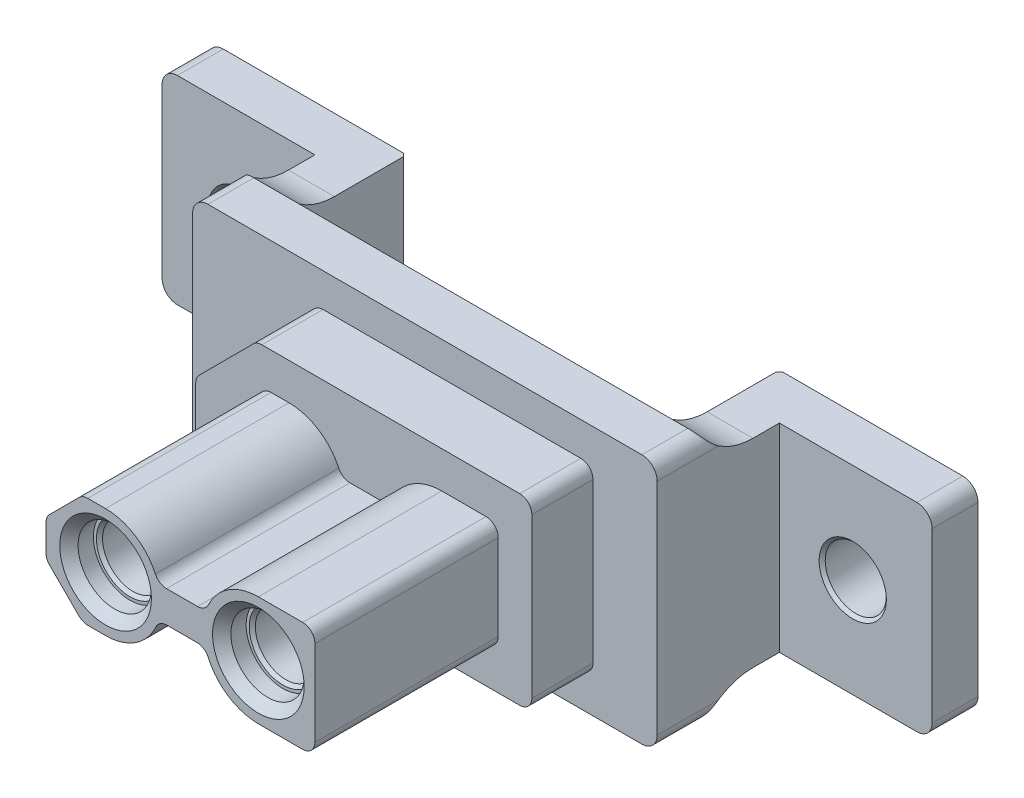
from build123d import *
from build123d.topology import SkipClean

# Parameters (mm, degrees)
SKETCH_1_R           = 1.2
EXTRUDE_1_DEPTH      = 6
EXTRUDE_START        = 2
SKETCH_2_R           = 1.2
EXTRUDE_2_DEPTH      = 2
EXTRUDE_START_2      = 1.5
SKETCH_3_W           = 15.2
SKETCH_3_H           = 8.2
SKETCH_3_R           = 1.2
EXTRUDE_3_DEPTH      = 1.5
SKETCH_4_W           = 1.5
SKETCH_4_H           = 6.5
EXTRUDE_4_DEPTH      = 4
SKETCH_5_W           = 1.5
SKETCH_5_H           = 6.5
EXTRUDE_5_DEPTH      = 5
SKETCH_6_W           = 1.5
SKETCH_6_H           = 6.5
EXTRUDE_6_DEPTH      = 5
FILLET_1_R           = 2
FILLET_2_R           = 0.5
SKETCH_7_R           = 1
CUT_EXTRUDE_1_DEPTH  = 5
CHAMFER_1_SIZE       = 0.1
CUT_EXTRUDE_2_DEPTH  = 2
EXTRUDE_7_DEPTH      = 4.9
EXTRUDE_7_DEPTH_BACK = 6.7
SKETCH_9_R           = 1.2
SKETCH_10_R          = 1
CUT_EXTRUDE_3_DEPTH  = 6
CHAMFER_2_SIZE       = 0.1
CHAMFER_3_SIZE       = 0.3
SKETCH_11_R          = 0.5
CUT_EXTRUDE_4_DEPTH  = 4.9
CUT_EXTRUDE_9_DEPTH  = 2.9
FILLET_3_R           = 0.1
CHAMFER_4_SIZE       = 0.3
CHAMFER_5_SIZE       = 0.4
SKETCH_13_W          = 1.346153846
SKETCH_13_H          = 0.358974359
EXTRUDE_8_DEPTH      = 0.1
EXTRUDE_13_DEPTH     = 0.1


with BuildPart() as part:
    # Эскиз1 → Бобышка-Вытянуть1 (new body)
    with BuildSketch(Plane.XY):
        with BuildLine():
            Line((2.258794489, 1.8), (3.708794489, 1.8))
            ThreePointArc((3.708794489, 1.8), (3.991637202, 1.682842712), (4.108794489, 1.4))
            Line((4.108794489, 1.4), (4.108794489, -1.4))
            ThreePointArc((4.108794489, -1.4), (3.991637202, -1.682842712), (3.708794489, -1.8))
            Line((3.708794489, -1.8), (2.258794489, -1.8))
            ThreePointArc((2.258794489, -1.8), (1.280391338, -1.510869707), (0.616305952, -0.736363636))
            ThreePointArc((0.616305952, -0.736363636), (0.468731422, -0.564251176), (0.251308499, -0.5))
            Line((0.251308499, -0.5), (-0.733719521, -0.5))
            ThreePointArc((-0.733719521, -0.5), (-0.951142443, -0.564251176), (-1.098716973, -0.736363636))
            ThreePointArc((-1.098716973, -0.736363636), (-1.762802359, -1.510869707), (-2.741205511, -1.8))
            Line((-2.741205511, -1.8), (-3.325520086, -1.8))
            ThreePointArc((-3.325520086, -1.8), (-3.478593459, -1.769551813), (-3.608362798, -1.682842712))
            Line((-3.608362798, -1.682842712), (-4.574048223, -0.717157288))
            ThreePointArc((-4.574048223, -0.717157288), (-4.660757324, -0.587387948), (-4.691205511, -0.434314575))
            Line((-4.691205511, -0.434314575), (-4.691205511, 0.434314575))
            ThreePointArc((-4.691205511, 0.434314575), (-4.660757324, 0.587387948), (-4.574048223, 0.717157288))
            Line((-4.574048223, 0.717157288), (-3.608362798, 1.682842712))
            ThreePointArc((-3.608362798, 1.682842712), (-3.478593459, 1.769551813), (-3.325520086, 1.8))
            Line((-3.325520086, 1.8), (-2.741205511, 1.8))
            ThreePointArc((-2.741205511, 1.8), (-1.773933587, 1.518020101), (-1.109718597, 0.760427807))
            ThreePointArc((-1.109718597, 0.760427807), (-0.962115266, 0.592073965), (-0.747165949, 0.529411765))
            Line((-0.747165949, 0.529411765), (0.264754928, 0.529411765))
            ThreePointArc((0.264754928, 0.529411765), (0.479704244, 0.592073965), (0.627307576, 0.760427807))
            ThreePointArc((0.627307576, 0.760427807), (1.291522566, 1.518020101), (2.258794489, 1.8))
        make_face()
        with Locations((2.258794489, 0)):
            Circle(SKETCH_1_R, mode=Mode.SUBTRACT)
        with Locations((-2.741205511, 0)):
            Circle(SKETCH_1_R, mode=Mode.SUBTRACT)
    extrude(amount=EXTRUDE_1_DEPTH)

    # Эскиз2 → Бобышка-Вытянуть2 (add)
    with SkipClean():  # the faces are left unmerged after this step: merging them gives an invalid solid
        with BuildSketch(Plane(origin=(0, 0, 0), x_dir=(-1, 0, 0), z_dir=(0, 0, -1)).offset(EXTRUDE_START)):
            with BuildLine():
                Line((3.908362798, 2.882842712), (5.674048223, 1.117157288))
                ThreePointArc((5.674048223, 1.117157288), (5.760757324, 0.987387948), (5.791205511, 0.834314575))
                Line((5.791205511, 0.834314575), (5.791205511, -2.6))
                ThreePointArc((5.791205511, -2.6), (5.674048223, -2.882842712), (5.391205511, -3))
                Line((5.391205511, -3), (-4.808794489, -3))
                ThreePointArc((-4.808794489, -3), (-5.091637202, -2.882842712), (-5.208794489, -2.6))
                Line((-5.208794489, -2.6), (-5.208794489, 2.6))
                ThreePointArc((-5.208794489, 2.6), (-5.091637202, 2.882842712), (-4.808794489, 3))
                Line((-4.808794489, 3), (3.625520086, 3))
                ThreePointArc((3.625520086, 3), (3.778593459, 2.969551813), (3.908362798, 2.882842712))
            make_face()
            with Locations((-2.258794489, 0)):
                Circle(SKETCH_2_R, mode=Mode.SUBTRACT)
            with Locations((2.741205511, 0)):
                Circle(SKETCH_2_R, mode=Mode.SUBTRACT)
        extrude(amount=-EXTRUDE_2_DEPTH)

    # Эскиз3 → Бобышка-Вытянуть3 (add)
    with SkipClean():  # the faces are left unmerged after this step: merging them gives an invalid solid
        with BuildSketch(Plane(origin=(0, 0, -2), x_dir=(-1, 0, 0), z_dir=(0, 0, -1)).offset(EXTRUDE_START_2)):
            with Locations((0.291205511, 0)):
                Rectangle(SKETCH_3_W, SKETCH_3_H)
            with Locations((2.741205511, 0)):
                Circle(SKETCH_3_R, mode=Mode.SUBTRACT)
            with Locations((-2.258794489, 0)):
                Circle(SKETCH_3_R, mode=Mode.SUBTRACT)
        extrude(amount=-EXTRUDE_3_DEPTH)

    # Эскиз4 → Бобышка-Вытянуть4 (add)
    with SkipClean():  # the faces are left unmerged after this step: merging them gives an invalid solid
        with BuildSketch(Plane(origin=(0, 0, -3.5), x_dir=(-1, 0, 0), z_dir=(0, 0, -1))):
            with Locations((-6.558794489, 0)):
                Rectangle(SKETCH_4_W, SKETCH_4_H)
            with Locations((7.141205511, 0)):
                Rectangle(SKETCH_4_W, SKETCH_4_H)
        extrude(amount=EXTRUDE_4_DEPTH)

    # Эскиз5 → Бобышка-Вытянуть5 (add)
    with SkipClean():  # the faces are left unmerged after this step: merging them gives an invalid solid
        with BuildSketch(Plane.ZY.offset(7.891205511)):
            with Locations((-6.75, 0)):
                Rectangle(SKETCH_5_W, SKETCH_5_H)
        extrude(amount=EXTRUDE_5_DEPTH)

    # Эскиз6 → Бобышка-Вытянуть6 (add)
    with SkipClean():  # the faces are left unmerged after this step: merging them gives an invalid solid
        with BuildSketch(Plane(origin=(7.308794489, 0, 0), x_dir=(0, 0, -1), z_dir=(1, 0, 0))):
            with Locations((6.75, 0)):
                Rectangle(SKETCH_6_W, SKETCH_6_H)
        extrude(amount=EXTRUDE_6_DEPTH)

    # Скругление1
    # the kernel refuses this fillet: 2 mm, written as the material it adds along each edge
    with BuildSketch(Plane(origin=(-7.891205511, 3.25, -3.5), x_dir=(-1.4802973661668755e-15, 1.0, -6.489449500614614e-12), z_dir=(1, 0, 0)), Plane(origin=(-6.391205511, -3.25, -3.5), x_dir=(0, -1.0, -6.475343137478438e-12), z_dir=(-1, 0, 0)), Plane(origin=(7.308794489, -3.25, -3.5), x_dir=(0, -1.0, -6.4972863690237275e-12), z_dir=(-1, 0, 0)), Plane(origin=(5.808794489, 3.25, -3.5), x_dir=(0, 1.0, -6.489449500614672e-12), z_dir=(1, 0, 0))) as fillet_1_piece_1:
        with BuildLine():
            CenterArc((2, -1.636306817), FILLET_1_R, 125.099632196, 54.900367805)
            Line((0, -1.636306817), (-0.04, -1.636306817))
            Line((-0.04, -1.636306817), (-0.04, 0))
            Line((-0.04, 0), (0, 0.04))
            ThreePointArc((0, 0.04), (0.425, 0.04), (0.827, 0.032726136))
            Line((0.827, 0.032726136), (0.85, 0))
        make_face()
    extrude(amount=1.5)

    # Скругление2
    # the kernel refuses this fillet: 0.5 mm, written as the material it adds along each edge
    with BuildSketch(Plane(origin=(5.808794489, 4.1, -3.5), x_dir=(0, 0, -1), z_dir=(0, -1, 0))) as fillet_2_piece_1_section:
        with BuildLine():
            CenterArc((FILLET_2_R, -FILLET_2_R), FILLET_2_R, 90, 90)
            Line((0, -FILLET_2_R), (0, 0))
            Line((0, 0), (FILLET_2_R, 0))
        make_face()
    fillet_2_piece_1 = extrude(amount=8.2, mode=Mode.PRIVATE)
    fillet_2_piece_1 = fillet_2_piece_1 - Plane(origin=(5.693650373, -5.25, -5.136306817), x_dir=(0, -1.0, -6e-12), z_dir=(1, 0, 0)) * Cylinder(2, 19, mode=Mode.PRIVATE)
    fillet_2_piece_1 = fillet_2_piece_1 - Plane(origin=(5.693650373, 5.25, -5.136306817), x_dir=(0, 1.0, -6e-12), z_dir=(-1, 0, 0)) * Cylinder(2, 19, mode=Mode.PRIVATE)
    add(fillet_2_piece_1)
    with BuildSketch(Plane(origin=(-6.391205511, 4.1, -3.5), x_dir=(0, 0, -1), z_dir=(0, -1, 0))) as fillet_2_piece_2_section:
        with BuildLine():
            CenterArc((FILLET_2_R, FILLET_2_R), FILLET_2_R, 180, 90)
            Line((0, FILLET_2_R), (0, 0))
            Line((0, 0), (FILLET_2_R, 0))
        make_face()
    fillet_2_piece_2 = extrude(amount=8.2, mode=Mode.PRIVATE)
    fillet_2_piece_2 = fillet_2_piece_2 - Plane(origin=(-6.276061394, 5.25, -5.136306817), x_dir=(0, 1.0, -6e-12), z_dir=(-1, 0, 0)) * Cylinder(2, 19, mode=Mode.PRIVATE)
    fillet_2_piece_2 = fillet_2_piece_2 - Plane(origin=(-6.276061394, -5.25, -5.136306817), x_dir=(0, -1.0, -6e-12), z_dir=(1, 0, 0)) * Cylinder(2, 19, mode=Mode.PRIVATE)
    add(fillet_2_piece_2)
    # the kernel refuses this fillet: 0.5 mm, written as the material it takes off along each edge
    with BuildSketch(Plane(origin=(-7.891205511, -4.1, -4.75), x_dir=(0, 1, 0), z_dir=(0, 0, 1)), Plane(origin=(7.308794489, 4.1, -4.75), x_dir=(0, -1, 0), z_dir=(0, 0, 1)), Plane(origin=(-12.891205511, -3.25, -4.75), x_dir=(1, 0, 0), z_dir=(0, 0, -1))) as fillet_2_2_piece_1:
        with BuildLine():
            CenterArc((FILLET_2_R, -FILLET_2_R), FILLET_2_R, 90, 90)
            Line((0, -FILLET_2_R), (0, 0))
            Line((0, 0), (FILLET_2_R, 0))
        make_face()
    extrude(amount=4, mode=Mode.SUBTRACT)
    with BuildSketch(Plane(origin=(-7.891205511, 4.1, -4.75), x_dir=(0, -1, 0), z_dir=(0, 0, 1)), Plane(origin=(7.308794489, -4.1, -4.75), x_dir=(0, 1, 0), z_dir=(0, 0, 1)), Plane(origin=(-12.891205511, 3.25, -8.75), x_dir=(0, -1, 0), z_dir=(0, 0, 1)), Plane(origin=(12.308794489, 3.25, -8.75), x_dir=(-1, 0, 0), z_dir=(0, 0, 1)), Plane(origin=(12.308794489, -3.25, -4.75), x_dir=(-1, 0, 0), z_dir=(0, 0, -1))) as fillet_2_2_piece_2:
        with BuildLine():
            CenterArc((FILLET_2_R, FILLET_2_R), FILLET_2_R, 180, 90)
            Line((0, FILLET_2_R), (0, 0))
            Line((0, 0), (FILLET_2_R, 0))
        make_face()
    extrude(amount=4, mode=Mode.SUBTRACT)

    # Эскиз7 → Вырез-Вытянуть1 (cut)
    with BuildSketch(Plane.XY.offset(-6)):
        with Locations((-10.291205511, 0)):
            Circle(SKETCH_7_R)
        with Locations((9.708794489, 0)):
            Circle(SKETCH_7_R)
    extrude(amount=-CUT_EXTRUDE_1_DEPTH, mode=Mode.SUBTRACT)

    # Фаска1
    chamfer_1_edges = [part.edges().sort_by_distance(p)[0] for p in [
        (5.808794489, 0, -7.5),
        (-6.391205511, 0, -7.5),
        (-11.291205511, 0, -6),
        (8.708794489, 0, -6),
    ]]
    chamfer(chamfer_1_edges, length=CHAMFER_1_SIZE)

    # Эскиз8 → Вырез-Вытянуть2 (cut)
    with BuildSketch(Plane(origin=(0, 0, -3.5), x_dir=(-1, 0, 0), z_dir=(0, 0, -1))):
        with BuildLine():
            Line((-2.258794489, 2), (2.741205511, 2))
            ThreePointArc((2.741205511, 2), (4.741205511, 0), (2.741205511, -2))
            Line((2.741205511, -2), (-3.258794489, -2))
            ThreePointArc((-3.258794489, -2), (-3.965901271, -1.707106781), (-4.258794489, -1))
            Line((-4.258794489, -1), (-4.258794489, 1))
            ThreePointArc((-4.258794489, 1), (-3.965901271, 1.707106781), (-3.258794489, 2))
            Line((-3.258794489, 2), (-2.258794489, 2))
        make_face()
    extrude(amount=-CUT_EXTRUDE_2_DEPTH, mode=Mode.SUBTRACT)

    # Эскиз9 → Бобышка-Вытянуть7 (add, two sides: drawn at the far end of the back side and taken through both)
    with BuildSketch(Plane(origin=(0, 0, -1.5), x_dir=(-1, 0, 0), z_dir=(0, 0, -1)).offset(-EXTRUDE_7_DEPTH_BACK)):
        with Locations(Location((-2.258794489, 0, 0), (0, 0, 180))):
            Circle(SKETCH_9_R)
        with Locations(Location((2.741205511, 0, 0), (0, 0, 180))):
            Circle(SKETCH_9_R)
    extrude(amount=EXTRUDE_7_DEPTH + EXTRUDE_7_DEPTH_BACK)

    # Эскиз10 → Вырез-Вытянуть3 (cut)
    with BuildSketch(Plane.XY.offset(5.2)):
        with Locations((-2.741205511, 0)):
            Circle(SKETCH_10_R)
        with Locations((2.258794489, 0)):
            Circle(SKETCH_10_R)
    extrude(amount=-CUT_EXTRUDE_3_DEPTH, mode=Mode.SUBTRACT)

    # Фаска2
    chamfer_2_edges = [part.edges().sort_by_distance(p)[0] for p in [
        (-3.741205511, 0, 5.2),
        (1.258794489, 0, 5.2),
    ]]
    chamfer(chamfer_2_edges, length=CHAMFER_2_SIZE)

    # Фаска3
    chamfer_3_edges = [part.edges().sort_by_distance(p)[0] for p in [
        (1.058794489, 0, 6),
        (-3.941205511, 0, 6),
    ]]
    chamfer(chamfer_3_edges, length=CHAMFER_3_SIZE)

    # Эскиз11 → Вырез-Вытянуть4 (cut)
    with BuildSketch(Plane(origin=(0, 0, -6.4), x_dir=(-1, 0, 0), z_dir=(0, 0, -1))):
        with Locations((-2.258794489, 0)):
            Circle(SKETCH_11_R)
        with Locations((2.741205511, 0)):
            Circle(SKETCH_11_R)
    extrude(amount=-CUT_EXTRUDE_4_DEPTH, mode=Mode.SUBTRACT)

    # Эскиз12 → Вырез-Вытянуть9 (cut)
    with BuildSketch(Plane(origin=(0, 0, -6.4), x_dir=(-1, 0, 0), z_dir=(0, 0, -1))):
        Polygon((-3.458794489, 0), (3.941205511, 0), (4.595085028, 3.242285216), (-4.658523769, 3.242285216), align=None)
    extrude(amount=-CUT_EXTRUDE_9_DEPTH, mode=Mode.SUBTRACT)

    # Скругление3
    fillet_3_edges = [part.edges().sort_by_distance(p)[0] for p in [
        (2.258794489, -0.5, -6.4),
        (-2.741205511, -0.5, -6.4),
        (-2.741205511, -1.2, -6.4),
        (2.258794489, -1.2, -6.4),
        (3.108794489, 0, -6.4),
        (1.408794489, 0, -6.4),
        (-1.891205511, 0, -6.4),
        (-3.591205511, 0, -6.4),
    ]]
    fillet(fillet_3_edges, radius=FILLET_3_R)

    # Фаска4
    chamfer_4_edges = [part.edges().sort_by_distance(p)[0] for p in [
        (2.758794489, 0, -1.5),
        (-2.241205511, 0, -1.5),
    ]]
    chamfer(chamfer_4_edges, length=CHAMFER_4_SIZE)

    # Фаска5
    chamfer_5_edges = [part.edges().sort_by_distance(p)[0] for p in [
        (-3.741205511, 0, -0.8),
        (1.258794489, 0, -0.8),
    ]]
    chamfer(chamfer_5_edges, length=CHAMFER_5_SIZE)

    # Эскиз13 → Бобышка-Вытянуть8 (add)
    with BuildSketch(Plane(origin=(0, 0, -3.5), x_dir=(-1, 0, 0), z_dir=(0, 0, -1))):
        Polygon((-3.440798391, 3.176805897), (-2.63951634, 3.176805897), (-2.63951634, 3.978087949), (-2.351054801, 3.978087949), (-2.351054801, 3.176805897), (-1.54977275, 3.176805897), (-1.54977275, 2.888344359), (-2.351054801, 2.888344359), (-2.351054801, 2.087062308), (-2.63951634, 2.087062308), (-2.63951634, 2.888344359), (-3.440798391, 2.888344359), align=None)
        with Locations((1.938889093, 3.014669105)):
            Rectangle(SKETCH_13_W, SKETCH_13_H)
    extrude(amount=EXTRUDE_8_DEPTH)

    # Эскиз14 → Бобышка-Вытянуть13 (add)
    # profile 1 of 5: a face of its own
    with BuildSketch(Plane(origin=(0, 0, -3.5), x_dir=(-1, 0, 0), z_dir=(0, 0, -1))):
        with BuildLine():
            Line((-3.107035782, -3.844522884), (-3.107035782, -3.636189551))
            Line((-3.107035782, -3.636189551), (-3.038676407, -3.636189551))
            add(Edge.make_bspline(
                [(-3.038676407, -3.636189551), (-3.025758735, -3.636122847), (-3.002726179, -3.636003914), (-2.972316243, -3.633949557), (-2.950054155, -3.631734993), (-2.934743369, -3.627329652), (-2.924975895, -3.620399853), (-2.918928165, -3.611352031), (-2.915318624, -3.600209672), (-2.914885284, -3.592057407), (-2.914652969, -3.587686946)],
                knots=[0, 0, 0, 0, 2.052523213, 3.65970388, 4.842635394, 5.606133253, 6.161486309, 6.706841923, 7.306733098, 8, 8, 8, 8], degree=3))
            add(Edge.make_bspline(
                [(-2.914652969, -3.587686946), (-2.914715799, -3.581489469), (-2.914837519, -3.569482956), (-2.917599166, -3.551845564), (-2.920213954, -3.534718891), (-2.923029123, -3.523542014), (-2.924418594, -3.518025488)],
                knots=[0, 0, 0, 0, 1.053051773, 2.04010098, 3.032660624, 4, 4, 4, 4], degree=3))
            Line((-2.924418594, -3.518025488), (-2.978455053, -3.344522884))
            Line((-2.978455053, -3.344522884), (-3.385030574, -3.344522884))
            Line((-3.385030574, -3.344522884), (-3.432231094, -3.49914528))
            add(Edge.make_bspline(
                [(-3.432231094, -3.49914528), (-3.435679597, -3.509644122), (-3.441723966, -3.528045982), (-3.448722324, -3.552838479), (-3.452500373, -3.573130986), (-3.452881782, -3.585394858), (-3.453064428, -3.591267676)],
                knots=[0, 0, 0, 0, 1.397716675, 2.449849722, 3.257677365, 4, 4, 4, 4], degree=3))
            add(Edge.make_bspline(
                [(-3.453064428, -3.591267676), (-3.452796486, -3.594714837), (-3.452260739, -3.601607412), (-3.446273548, -3.610819506), (-3.437504768, -3.618845537), (-3.425081064, -3.62513054), (-3.409748639, -3.630294197), (-3.391432421, -3.633584461), (-3.370446119, -3.635989945), (-3.355525426, -3.636120282), (-3.347595678, -3.636189551)],
                knots=[0, 0, 0, 0, 0.653573329, 1.306815147, 2.04329018, 2.918716864, 3.952107033, 5.139965624, 6.480006763, 8, 8, 8, 8], degree=3))
            Line((-3.347595678, -3.636189551), (-3.272725886, -3.636189551))
            Line((-3.272725886, -3.636189551), (-3.272725886, -3.844522884))
            Line((-3.272725886, -3.844522884), (-3.940694636, -3.844522884))
            Line((-3.940694636, -3.844522884), (-3.940694636, -3.636189551))
            Line((-3.940694636, -3.636189551), (-3.885030574, -3.636189551))
            add(Edge.make_bspline(
                [(-3.885030574, -3.636189551), (-3.875854747, -3.635841657), (-3.857930853, -3.635162089), (-3.832426024, -3.627177475), (-3.809098107, -3.61501866), (-3.787943832, -3.597382176), (-3.769112777, -3.573954862), (-3.751377162, -3.544917916), (-3.735794722, -3.509477146), (-3.72674676, -3.483588544), (-3.721944636, -3.469848405)],
                knots=[0, 0, 0, 0, 0.873028564, 1.705358343, 2.525418189, 3.371489511, 4.313035563, 5.382398221, 6.610731676, 8, 8, 8, 8], degree=3))
            Line((-3.721944636, -3.469848405), (-3.330994115, -2.344522884))
            Line((-3.330994115, -2.344522884), (-2.785095678, -2.344522884))
            Line((-2.785095678, -2.344522884), (-2.431254532, -3.464965592))
            add(Edge.make_bspline(
                [(-2.431254532, -3.464965592), (-2.428392256, -3.474535568), (-2.422933952, -3.492785323), (-2.414138443, -3.518370133), (-2.405656195, -3.541094612), (-2.397367658, -3.560796362), (-2.389059342, -3.577549163), (-2.381575474, -3.591646434), (-2.373705587, -3.602509777), (-2.363518423, -3.613426279), (-2.347731771, -3.622989014), (-2.325518629, -3.630535195), (-2.299085629, -3.635471618), (-2.280020555, -3.635938935), (-2.269796199, -3.636189551)],
                knots=[0, 0, 0, 0, 1.371589294, 2.615593568, 3.714308812, 4.702369718, 5.548695683, 6.282468054, 6.890480686, 7.38580155, 8.324069927, 9.384532165, 10.597357959, 12, 12, 12, 12], degree=3))
            Line((-2.269796199, -3.636189551), (-2.190694636, -3.636189551))
            Line((-2.190694636, -3.636189551), (-2.190694636, -3.844522884))
            Line((-2.190694636, -3.844522884), (-3.107035782, -3.844522884))
        make_face()
        Polygon((-3.049744115, -3.136189551), (-3.187113907, -2.688272884), (-3.315694636, -3.136189551), align=None, mode=Mode.SUBTRACT)
    # profile 2 of 5: a face of its own
    with BuildSketch(Plane(origin=(0, 0, -3.5), x_dir=(-1, 0, 0), z_dir=(0, 0, -1))):
        with BuildLine():
            add(Edge.make_bspline(
                [(-1.493754532, -2.894653092), (-1.480079133, -2.882244217), (-1.453232835, -2.857884244), (-1.409975432, -2.826307046), (-1.365666264, -2.79934188), (-1.319622767, -2.777623322), (-1.271596839, -2.760907625), (-1.221343459, -2.748893016), (-1.168561293, -2.74152283), (-1.132559182, -2.740750251), (-1.11419724, -2.740356217)],
                knots=[0, 0, 0, 0, 1.053018965, 2.067190937, 3.050408278, 4.00867, 4.966151388, 5.946733668, 6.952784848, 8, 8, 8, 8], degree=3))
            add(Edge.make_bspline(
                [(-1.11419724, -2.740356217), (-1.097579882, -2.740713012), (-1.065536064, -2.741401032), (-1.019349106, -2.747155579), (-0.977179545, -2.757331314), (-0.93854252, -2.770858756), (-0.903588365, -2.788959933), (-0.872209534, -2.811352811), (-0.843530294, -2.837503466), (-0.82786936, -2.858143274), (-0.819926407, -2.868611426)],
                knots=[0, 0, 0, 0, 1.191989506, 2.298554025, 3.331382782, 4.299111693, 5.22876775, 6.144598789, 7.058972868, 8, 8, 8, 8], degree=3))
            add(Edge.make_bspline(
                [(-0.819926407, -2.868611426), (-0.807061417, -2.858524214), (-0.781518848, -2.838496737), (-0.740820031, -2.812477898), (-0.698463064, -2.790566975), (-0.654840049, -2.772289327), (-0.609885377, -2.757848508), (-0.563859997, -2.747937996), (-0.517056399, -2.741362354), (-0.485530341, -2.74069303), (-0.46966599, -2.740356217)],
                knots=[0, 0, 0, 0, 1.03046703, 2.04592268, 3.040532517, 4.034247603, 5.025320828, 6.013129188, 7.000178936, 8, 8, 8, 8], degree=3))
            add(Edge.make_bspline(
                [(-0.46966599, -2.740356217), (-0.453814534, -2.740564703), (-0.42324363, -2.740966786), (-0.379157201, -2.745190494), (-0.338681337, -2.752337026), (-0.301643461, -2.761917957), (-0.268333766, -2.774570796), (-0.238556714, -2.789997811), (-0.212239512, -2.808225798), (-0.189445982, -2.829828771), (-0.169430107, -2.854624548), (-0.152948464, -2.883822542), (-0.138750312, -2.916683359), (-0.126833191, -2.953587802), (-0.118482747, -2.994680088), (-0.11189881, -3.039767655), (-0.108052989, -3.088922865), (-0.107597452, -3.123053568), (-0.107361303, -3.140746842)],
                knots=[0, 0, 0, 0, 1.206996871, 2.327797712, 3.368536997, 4.334718522, 5.237161044, 6.076231881, 6.883231776, 7.666613732, 8.460345101, 9.300879718, 10.211308613, 11.183514848, 12.248417226, 13.400763928, 14.652562316, 16, 16, 16, 16], degree=3))
            Line((-0.107361303, -3.140746842), (-0.107361303, -3.533976009))
            add(Edge.make_bspline(
                [(-0.107361303, -3.533976009), (-0.107105056, -3.543546504), (-0.106634996, -3.561102651), (-0.102019291, -3.584915241), (-0.094012985, -3.603678952), (-0.081682448, -3.618053715), (-0.063084634, -3.626366864), (-0.039360489, -3.632307856), (-0.008803601, -3.635508697), (0.013728542, -3.635948196), (0.026102239, -3.636189551)],
                knots=[0, 0, 0, 0, 1.148553219, 2.106909632, 2.894163848, 3.577003652, 4.322948611, 5.293278341, 6.513583252, 8, 8, 8, 8], degree=3))
            Line((0.026102239, -3.636189551), (0.059305364, -3.636189551))
            Line((0.059305364, -3.636189551), (0.059305364, -3.844522884))
            Line((0.059305364, -3.844522884), (-0.669861303, -3.844522884))
            Line((-0.669861303, -3.844522884), (-0.669861303, -3.636189551))
            add(Edge.make_bspline(
                [(-0.669861303, -3.636189551), (-0.660079031, -3.635625975), (-0.642261683, -3.634599483), (-0.618261413, -3.630551919), (-0.599639888, -3.62468334), (-0.585145507, -3.616225946), (-0.575821639, -3.602452491), (-0.569507095, -3.584393545), (-0.566392985, -3.560876931), (-0.565942664, -3.543530244), (-0.565694636, -3.533976009)],
                knots=[0, 0, 0, 0, 1.354397338, 2.46688781, 3.354129108, 4.049167495, 4.736388894, 5.600363929, 6.678324641, 8, 8, 8, 8], degree=3))
            Line((-0.565694636, -3.533976009), (-0.565694636, -3.161905696))
            add(Edge.make_bspline(
                [(-0.565694636, -3.161905696), (-0.566031507, -3.144104683), (-0.566655009, -3.111157421), (-0.570431506, -3.065782455), (-0.577692621, -3.028586452), (-0.58774076, -2.998859079), (-0.602052713, -2.976074088), (-0.620838676, -2.959963085), (-0.643900489, -2.949959158), (-0.660751391, -2.949124604), (-0.669535782, -2.948689551)],
                knots=[0, 0, 0, 0, 1.604292727, 2.969328209, 4.096866203, 5.012429325, 5.7826389, 6.490022326, 7.212847224, 8, 8, 8, 8], degree=3))
            add(Edge.make_bspline(
                [(-0.669535782, -2.948689551), (-0.679669049, -2.949444823), (-0.699363036, -2.950912692), (-0.726579433, -2.9643697), (-0.749048436, -2.986193758), (-0.762751516, -3.010749381), (-0.77182353, -3.033714459), (-0.778129142, -3.05393373), (-0.783142211, -3.07649408), (-0.787294034, -3.101504297), (-0.791019682, -3.128618402), (-0.793011901, -3.158305406), (-0.794882172, -3.190202839), (-0.794868391, -3.21235804), (-0.794861303, -3.223754655)],
                knots=[0, 0, 0, 0, 1.083717302, 2.1062026, 3.186902936, 4.405128215, 5.096046714, 5.841244638, 6.678757704, 7.578071107, 8.566184099, 9.61908451, 10.775259356, 12, 12, 12, 12], degree=3))
            Line((-0.794861303, -3.223754655), (-0.794861303, -3.533976009))
            add(Edge.make_bspline(
                [(-0.794861303, -3.533976009), (-0.794689366, -3.543635357), (-0.794375416, -3.561272995), (-0.79187349, -3.58509366), (-0.786800797, -3.603354785), (-0.779910782, -3.617233759), (-0.768945942, -3.626460512), (-0.754616881, -3.632081366), (-0.736864144, -3.635531096), (-0.723808058, -3.635958208), (-0.716736303, -3.636189551)],
                knots=[0, 0, 0, 0, 1.519227862, 2.774058043, 3.751271498, 4.491970911, 5.169244951, 5.948808583, 6.888983627, 8, 8, 8, 8], degree=3))
            Line((-0.716736303, -3.636189551), (-0.690694636, -3.636189551))
            Line((-0.690694636, -3.636189551), (-0.690694636, -3.844522884))
            Line((-0.690694636, -3.844522884), (-1.357361303, -3.844522884))
            Line((-1.357361303, -3.844522884), (-1.357361303, -3.636189551))
            Line((-1.357361303, -3.636189551), (-1.333272761, -3.636189551))
            add(Edge.make_bspline(
                [(-1.333272761, -3.636189551), (-1.32597538, -3.636011474), (-1.312663765, -3.635686633), (-1.294619799, -3.631700929), (-1.280062586, -3.625812033), (-1.268819978, -3.616257336), (-1.261553989, -3.602226282), (-1.256681965, -3.583961831), (-1.253512884, -3.560664704), (-1.253307344, -3.543427827), (-1.253194636, -3.533976009)],
                knots=[0, 0, 0, 0, 1.139144051, 2.077984866, 2.875846139, 3.573555582, 4.333511563, 5.305663988, 6.522564435, 8, 8, 8, 8], degree=3))
            Line((-1.253194636, -3.533976009), (-1.253194636, -3.161905696))
            add(Edge.make_bspline(
                [(-1.253194636, -3.161905696), (-1.253478762, -3.144097892), (-1.254004807, -3.11112757), (-1.258396693, -3.06582116), (-1.265370681, -3.028493389), (-1.275976484, -2.998939854), (-1.290183967, -2.975947471), (-1.309362064, -2.959966267), (-1.3328107, -2.949914612), (-1.349984648, -2.949110923), (-1.358988907, -2.948689551)],
                knots=[0, 0, 0, 0, 1.596264708, 2.955409887, 4.077305584, 4.991657613, 5.758012994, 6.469280834, 7.197447628, 8, 8, 8, 8], degree=3))
            add(Edge.make_bspline(
                [(-1.358988907, -2.948689551), (-1.369005071, -2.949455001), (-1.388475175, -2.950942935), (-1.415523115, -2.964271749), (-1.437065403, -2.986776075), (-1.450859155, -3.011067542), (-1.460182861, -3.034166482), (-1.465716125, -3.054795798), (-1.471080996, -3.077659806), (-1.475156642, -3.103011468), (-1.478446734, -3.130812262), (-1.480511724, -3.161017076), (-1.48238915, -3.193675664), (-1.482370817, -3.216264437), (-1.482361303, -3.227986426)],
                knots=[0, 0, 0, 0, 1.063035842, 2.066401791, 3.129437632, 4.337284908, 5.022317504, 5.780022232, 6.610400563, 7.524858571, 8.514603688, 9.593126299, 10.751001477, 12, 12, 12, 12], degree=3))
            Line((-1.482361303, -3.227986426), (-1.482361303, -3.533976009))
            add(Edge.make_bspline(
                [(-1.482361303, -3.533976009), (-1.48212434, -3.543210844), (-1.481690055, -3.560135654), (-1.478367083, -3.583212963), (-1.472462208, -3.601652761), (-1.463345396, -3.615866834), (-1.449998102, -3.625612349), (-1.433008202, -3.631770369), (-1.412111039, -3.635628476), (-1.396878043, -3.635992176), (-1.388611303, -3.636189551)],
                knots=[0, 0, 0, 0, 1.351177136, 2.476321177, 3.400288242, 4.166586359, 4.903361609, 5.773214902, 6.791553883, 8, 8, 8, 8], degree=3))
            Line((-1.388611303, -3.636189551), (-1.378194636, -3.636189551))
            Line((-1.378194636, -3.636189551), (-1.378194636, -3.844522884))
            Line((-1.378194636, -3.844522884), (-2.107361303, -3.844522884))
            Line((-2.107361303, -3.844522884), (-2.107361303, -3.636189551))
            Line((-2.107361303, -3.636189551), (-2.062764949, -3.636189551))
            add(Edge.make_bspline(
                [(-2.062764949, -3.636189551), (-2.051367737, -3.635941713), (-2.030566438, -3.635489379), (-2.002473656, -3.632359653), (-1.980766712, -3.626351609), (-1.963860892, -3.61780518), (-1.95277738, -3.603472445), (-1.945381441, -3.584847161), (-1.94162819, -3.561027837), (-1.941024505, -3.543534714), (-1.940694636, -3.533976009)],
                knots=[0, 0, 0, 0, 1.440125113, 2.628403763, 3.55654281, 4.280734815, 4.97215159, 5.789213059, 6.791967608, 8, 8, 8, 8], degree=3))
            Line((-1.940694636, -3.533976009), (-1.940694636, -3.092569759))
            add(Edge.make_bspline(
                [(-1.940694636, -3.092569759), (-1.941026346, -3.08290108), (-1.941633978, -3.065189823), (-1.94536059, -3.041171204), (-1.952669412, -3.022431902), (-1.963994008, -3.008436592), (-1.980697509, -2.999784466), (-2.002551924, -2.994333957), (-2.030549714, -2.991004414), (-2.051361817, -2.990585657), (-2.062764949, -2.990356217)],
                knots=[0, 0, 0, 0, 1.219751925, 2.234363003, 3.050110864, 3.729893098, 4.452920803, 5.375821981, 6.562190208, 8, 8, 8, 8], degree=3))
            Line((-2.062764949, -2.990356217), (-2.107361303, -2.990356217))
            Line((-2.107361303, -2.990356217), (-2.107361303, -2.782022884))
            Line((-2.107361303, -2.782022884), (-1.493754532, -2.782022884))
            Line((-1.493754532, -2.782022884), (-1.493754532, -2.894653092))
        make_face()
    # profile 3 of 5: a face of its own
    with BuildSketch(Plane(origin=(0, 0, -3.5), x_dir=(-1, 0, 0), z_dir=(0, 0, -1))):
        with BuildLine():
            add(Edge.make_bspline(
                [(1.002339218, -3.752074967), (0.992427128, -3.762484986), (0.972230416, -3.783696269), (0.935764943, -3.810134236), (0.894821673, -3.833529748), (0.848762814, -3.85238747), (0.798680458, -3.86777218), (0.744660873, -3.878256434), (0.687184521, -3.884913222), (0.64764937, -3.885756393), (0.627339218, -3.886189551)],
                knots=[0, 0, 0, 0, 0.839842113, 1.711248596, 2.624295403, 3.59507321, 4.617716592, 5.686440299, 6.811469041, 8, 8, 8, 8], degree=3))
            add(Edge.make_bspline(
                [(0.627339218, -3.886189551), (0.614202721, -3.885920858), (0.588638996, -3.88539798), (0.551402229, -3.881889136), (0.516489734, -3.87565674), (0.483756315, -3.867304033), (0.453359044, -3.856337921), (0.425479821, -3.842398063), (0.399691937, -3.826612243), (0.376297825, -3.808163308), (0.355529695, -3.787411965), (0.337469121, -3.764477594), (0.32234369, -3.739408115), (0.310045018, -3.712278072), (0.300155686, -3.683196371), (0.29348309, -3.651947988), (0.289077643, -3.618737598), (0.288677223, -3.595839973), (0.288472031, -3.584106217)],
                knots=[0, 0, 0, 0, 1.220900662, 2.375882205, 3.471812, 4.513798441, 5.512375499, 6.46849786, 7.405984131, 8.317900022, 9.230651946, 10.128406094, 11.024289152, 11.944862667, 12.892008158, 13.87317087, 14.910118686, 16, 16, 16, 16], degree=3))
            add(Edge.make_bspline(
                [(0.288472031, -3.584106217), (0.288742417, -3.572705005), (0.289269121, -3.550495766), (0.292755391, -3.518226058), (0.298990847, -3.488181556), (0.307333034, -3.460281775), (0.318435722, -3.434684824), (0.332183629, -3.411444997), (0.348339753, -3.390445864), (0.366862583, -3.371026206), (0.38928943, -3.353541879), (0.415887057, -3.337330852), (0.446986348, -3.322106949), (0.48251413, -3.307942964), (0.522404196, -3.294599468), (0.56675873, -3.282342353), (0.615628026, -3.270936136), (0.649880731, -3.264525345), (0.667703801, -3.261189551)],
                knots=[0, 0, 0, 0, 0.982300398, 1.91349345, 2.791701618, 3.622663584, 4.418107195, 5.189284393, 5.942807455, 6.696504467, 7.495127892, 8.385001201, 9.375849858, 10.474721571, 11.677916063, 12.998003482, 14.437939602, 16, 16, 16, 16], degree=3))
            add(Edge.make_bspline(
                [(0.667703801, -3.261189551), (0.682469722, -3.258416834), (0.710642409, -3.253126621), (0.75065065, -3.244833472), (0.786349343, -3.235961111), (0.817825509, -3.227104986), (0.844908958, -3.217544066), (0.867857581, -3.208438648), (0.886285994, -3.198528675), (0.905594146, -3.185839768), (0.923832087, -3.165707593), (0.93907216, -3.136697228), (0.94827142, -3.102448258), (0.949144153, -3.077873029), (0.949604843, -3.064900488)],
                knots=[0, 0, 0, 0, 1.411637834, 2.693339149, 3.838185285, 4.867482012, 5.763835528, 6.536308607, 7.183995575, 7.726924141, 8.700805417, 9.695123872, 10.783323639, 12, 12, 12, 12], degree=3))
            add(Edge.make_bspline(
                [(0.949604843, -3.064900488), (0.949179582, -3.051803866), (0.948365959, -3.026747014), (0.938363398, -2.991464517), (0.92323727, -2.959986414), (0.900817491, -2.933915382), (0.873874948, -2.912198601), (0.841664878, -2.896928703), (0.805054893, -2.887563826), (0.779200694, -2.886661327), (0.765685572, -2.886189551)],
                knots=[0, 0, 0, 0, 1.081758701, 2.069653397, 3.014397045, 3.95244517, 4.893074136, 5.862013961, 6.882381135, 8, 8, 8, 8], degree=3))
            add(Edge.make_bspline(
                [(0.765685572, -2.886189551), (0.756206233, -2.886647811), (0.736795442, -2.88758619), (0.707657127, -2.894869249), (0.677776356, -2.906436591), (0.658569814, -2.917284734), (0.648498072, -2.922973405)],
                knots=[0, 0, 0, 0, 0.914508999, 1.872634901, 2.884428481, 4, 4, 4, 4], degree=3))
            add(Edge.make_bspline(
                [(0.648498072, -2.922973405), (0.659656374, -2.925953625), (0.680736743, -2.931583885), (0.709466785, -2.943833796), (0.733910191, -2.95799341), (0.753856414, -2.974858267), (0.769590674, -2.993935649), (0.780597275, -3.015830602), (0.787188665, -3.040214974), (0.788035934, -3.057371797), (0.788472031, -3.066202571)],
                knots=[0, 0, 0, 0, 1.267212212, 2.394029366, 3.420156048, 4.358720584, 5.248490662, 6.11733915, 7.03097718, 8, 8, 8, 8], degree=3))
            add(Edge.make_bspline(
                [(0.788472031, -3.066202571), (0.787841631, -3.07715221), (0.786602506, -3.098675016), (0.774977492, -3.129172534), (0.755655748, -3.155987279), (0.729204037, -3.178509417), (0.697133081, -3.197313917), (0.659416189, -3.20985723), (0.617301239, -3.218361813), (0.587564703, -3.219123972), (0.572000676, -3.219522884)],
                knots=[0, 0, 0, 0, 0.884321218, 1.738237531, 2.601692089, 3.536102254, 4.532655681, 5.594633046, 6.741037127, 8, 8, 8, 8], degree=3))
            add(Edge.make_bspline(
                [(0.572000676, -3.219522884), (0.553717845, -3.219104676), (0.519045924, -3.218311578), (0.470519553, -3.208608118), (0.428081296, -3.194025557), (0.392690646, -3.172397918), (0.364533123, -3.144801263), (0.344165371, -3.111809816), (0.332125843, -3.073516619), (0.330818585, -3.046433825), (0.330138697, -3.032348405)],
                knots=[0, 0, 0, 0, 1.265770357, 2.400431837, 3.416669473, 4.362515821, 5.25096502, 6.125835589, 7.025270716, 8, 8, 8, 8], degree=3))
            add(Edge.make_bspline(
                [(0.330138697, -3.032348405), (0.330585477, -3.021142811), (0.331456634, -2.999293478), (0.338044998, -2.967358842), (0.349733433, -2.937552561), (0.36531455, -2.909364828), (0.385661682, -2.88329481), (0.410265959, -2.859102006), (0.439535203, -2.836916331), (0.473194953, -2.81695662), (0.510570011, -2.798673106), (0.551845498, -2.783194373), (0.596561458, -2.769888229), (0.644718882, -2.758864577), (0.696362852, -2.750428441), (0.75147733, -2.744765276), (0.810124391, -2.741113137), (0.850423761, -2.740613327), (0.871154322, -2.740356217)],
                knots=[0, 0, 0, 0, 0.788922789, 1.538288593, 2.28335597, 3.035987677, 3.798716068, 4.603867732, 5.45978537, 6.378489449, 7.355955238, 8.386326133, 9.479132709, 10.63958234, 11.863227943, 13.16199968, 14.540092878, 16, 16, 16, 16], degree=3))
            add(Edge.make_bspline(
                [(0.871154322, -2.740356217), (0.893947997, -2.74056339), (0.938383508, -2.740967267), (1.003120029, -2.745331821), (1.064065569, -2.75207951), (1.120755928, -2.761221119), (1.172099772, -2.773304621), (1.217646103, -2.786473373), (1.256442081, -2.802581882), (1.278938284, -2.815858883), (1.289448593, -2.822061946)],
                knots=[0, 0, 0, 0, 1.269098629, 2.474065499, 3.611065001, 4.68287568, 5.66925945, 6.546632143, 7.32098121, 8, 8, 8, 8], degree=3))
            add(Edge.make_bspline(
                [(1.289448593, -2.822061946), (1.30030126, -2.829818349), (1.321278317, -2.844810654), (1.348322555, -2.871169826), (1.370102129, -2.899672074), (1.38397469, -2.925563439), (1.392878209, -2.947956567), (1.3981016, -2.96712645), (1.403166175, -2.988467343), (1.406915654, -3.012086805), (1.409751903, -3.037951157), (1.412103532, -3.066057197), (1.413360078, -3.096464241), (1.413433962, -3.11752532), (1.413472031, -3.128377051)],
                knots=[0, 0, 0, 0, 1.378612592, 2.664712422, 3.890656794, 5.076042068, 5.691041292, 6.380347588, 7.1292437, 7.95977173, 8.852396257, 9.821061955, 10.877301134, 12, 12, 12, 12], degree=3))
            Line((1.413472031, -3.128377051), (1.413472031, -3.551228613))
            add(Edge.make_bspline(
                [(1.413472031, -3.551228613), (1.413565775, -3.557310946), (1.413735469, -3.568320979), (1.415612654, -3.583202675), (1.418588195, -3.594738794), (1.423241795, -3.603555458), (1.430686995, -3.6091395), (1.439855199, -3.612885896), (1.451343385, -3.615171863), (1.459684323, -3.615290972), (1.464253281, -3.615356217)],
                knots=[0, 0, 0, 0, 1.502017448, 2.718901361, 3.694605377, 4.439369597, 5.125903634, 5.942456188, 6.872928977, 8, 8, 8, 8], degree=3))
            add(Edge.make_bspline(
                [(1.464253281, -3.615356217), (1.468943014, -3.615339394), (1.47754419, -3.61530854), (1.48922705, -3.61244219), (1.498909846, -3.608890438), (1.506522169, -3.602798436), (1.511839127, -3.594095777), (1.515233718, -3.582472533), (1.517438205, -3.567914072), (1.51756817, -3.557098034), (1.517638697, -3.551228613)],
                knots=[0, 0, 0, 0, 1.138994247, 2.088965097, 2.919393005, 3.634292929, 4.419658348, 5.365196962, 6.570200153, 8, 8, 8, 8], degree=3))
            Line((1.517638697, -3.551228613), (1.517638697, -3.427856217))
            Line((1.517638697, -3.427856217), (1.663472031, -3.427856217))
            Line((1.663472031, -3.427856217), (1.663472031, -3.56164528))
            add(Edge.make_bspline(
                [(1.663472031, -3.56164528), (1.663244425, -3.575652897), (1.662805894, -3.602641564), (1.65883774, -3.641599686), (1.652499659, -3.677462443), (1.643322184, -3.710383383), (1.631766711, -3.740212232), (1.617701758, -3.767162181), (1.600592316, -3.790721813), (1.580921189, -3.811601143), (1.557997899, -3.82923943), (1.532284175, -3.844762177), (1.503289143, -3.857673335), (1.470915034, -3.867977309), (1.43548375, -3.876501478), (1.396704183, -3.882210393), (1.354713414, -3.88534324), (1.325695246, -3.885900044), (1.310607447, -3.886189551)],
                knots=[0, 0, 0, 0, 1.207710971, 2.326913156, 3.373124982, 4.344875002, 5.269337988, 6.127486821, 6.958576845, 7.772688311, 8.592587371, 9.44474601, 10.357819852, 11.32251566, 12.371110136, 13.497331777, 14.69875472, 16, 16, 16, 16], degree=3))
            add(Edge.make_bspline(
                [(1.310607447, -3.886189551), (1.293549826, -3.885876819), (1.260615268, -3.885273004), (1.213211433, -3.878910467), (1.169478262, -3.869022478), (1.129451149, -3.854639379), (1.092597207, -3.835974187), (1.059506386, -3.812144078), (1.028462288, -3.784769415), (1.011149027, -3.763100924), (1.002339218, -3.752074967)],
                knots=[0, 0, 0, 0, 1.169881316, 2.258786388, 3.275654567, 4.241345681, 5.17046084, 6.100112904, 7.033247324, 8, 8, 8, 8], degree=3))
        make_face()
        with BuildLine():
            add(Edge.make_bspline(
                [(0.953511093, -3.344522884), (0.947663113, -3.348878737), (0.935269947, -3.358109755), (0.915195469, -3.372543459), (0.892632357, -3.388451682), (0.876394196, -3.399148264), (0.867899114, -3.404744238)],
                knots=[0, 0, 0, 0, 0.835824153, 1.771296685, 2.834041818, 4, 4, 4, 4], degree=3))
            add(Edge.make_bspline(
                [(0.867899114, -3.404744238), (0.858384562, -3.411368598), (0.840190772, -3.424035743), (0.815292852, -3.443805195), (0.794365096, -3.463630141), (0.777268986, -3.483270608), (0.763660577, -3.502441247), (0.753922785, -3.521572828), (0.74809749, -3.540691423), (0.747228384, -3.553471637), (0.746805364, -3.559692155)],
                knots=[0, 0, 0, 0, 1.364075805, 2.608395045, 3.737303311, 4.751090268, 5.66846674, 6.496450078, 7.268176613, 8, 8, 8, 8], degree=3))
            add(Edge.make_bspline(
                [(0.746805364, -3.559692155), (0.747054333, -3.567973431), (0.747534838, -3.583956075), (0.752982448, -3.606544167), (0.761106855, -3.627076303), (0.772833866, -3.644767611), (0.786900498, -3.659754377), (0.803820516, -3.669835903), (0.822188787, -3.677076959), (0.835381158, -3.677591122), (0.842182968, -3.677856217)],
                knots=[0, 0, 0, 0, 1.168985481, 2.256111111, 3.267929447, 4.276833386, 5.242795527, 6.145734678, 7.043965539, 8, 8, 8, 8], degree=3))
            add(Edge.make_bspline(
                [(0.842182968, -3.677856217), (0.850409465, -3.677334789), (0.866502815, -3.676314729), (0.889151333, -3.666933121), (0.908891347, -3.651707881), (0.925406444, -3.630653833), (0.939048271, -3.605028432), (0.948222459, -3.5747278), (0.954207773, -3.540614537), (0.954817791, -3.516426797), (0.955138697, -3.503702571)],
                knots=[0, 0, 0, 0, 0.85028107, 1.663389876, 2.498636502, 3.41102397, 4.418134867, 5.493217041, 6.681279361, 8, 8, 8, 8], degree=3))
            Line((0.955138697, -3.503702571), (0.955138697, -3.49523903))
            Line((0.955138697, -3.49523903), (0.953511093, -3.344522884))
        make_face(mode=Mode.SUBTRACT)
    # profile 4 of 5: a face of its own
    with BuildSketch(Plane(origin=(0, 0, -3.5), x_dir=(-1, 0, 0), z_dir=(0, 0, -1))):
        with BuildLine():
            Line((2.079162135, -3.861124446), (1.913472031, -3.861124446))
            Line((1.913472031, -3.861124446), (1.913472031, -3.469522884))
            Line((1.913472031, -3.469522884), (2.121805364, -3.469522884))
            add(Edge.make_bspline(
                [(2.121805364, -3.469522884), (2.127832893, -3.486012019), (2.139459951, -3.517819434), (2.164238573, -3.560669404), (2.19376522, -3.597122701), (2.228532425, -3.627038328), (2.268563609, -3.650023577), (2.31349777, -3.666277368), (2.363343657, -3.676208268), (2.398232491, -3.677291893), (2.416401718, -3.677856217)],
                knots=[0, 0, 0, 0, 1.078833137, 2.081060887, 3.030155937, 3.953651357, 4.887136512, 5.854750874, 6.882808263, 8, 8, 8, 8], degree=3))
            add(Edge.make_bspline(
                [(2.416401718, -3.677856217), (2.428141968, -3.677704352), (2.449868051, -3.677423316), (2.479823534, -3.672993889), (2.504954438, -3.667024404), (2.525219243, -3.657474069), (2.540949618, -3.6448882), (2.55171158, -3.628715428), (2.558521661, -3.609694493), (2.559036189, -3.595886932), (2.559305364, -3.588663509)],
                knots=[0, 0, 0, 0, 1.469319168, 2.719068973, 3.787504613, 4.693519032, 5.504703679, 6.277735862, 7.098997723, 8, 8, 8, 8], degree=3))
            add(Edge.make_bspline(
                [(2.559305364, -3.588663509), (2.558773692, -3.583465955), (2.557663416, -3.572612045), (2.548856117, -3.557309517), (2.535784605, -3.542339703), (2.517124676, -3.52833122), (2.493785167, -3.514296973), (2.465253736, -3.500795986), (2.43164272, -3.487472102), (2.407230506, -3.479575684), (2.394266301, -3.475382259)],
                knots=[0, 0, 0, 0, 0.590101119, 1.232292169, 1.969340702, 2.850828577, 3.878220936, 5.073962577, 6.446115964, 8, 8, 8, 8], degree=3))
            add(Edge.make_bspline(
                [(2.394266301, -3.475382259), (2.385482732, -3.472544311), (2.368895043, -3.467184873), (2.345465877, -3.459894192), (2.325172403, -3.452846416), (2.312565047, -3.448676097), (2.306701197, -3.446736426)],
                knots=[0, 0, 0, 0, 1.202258392, 2.270453644, 3.195564855, 4, 4, 4, 4], degree=3))
            add(Edge.make_bspline(
                [(2.306701197, -3.446736426), (2.285942257, -3.440111285), (2.246122642, -3.427402999), (2.189564716, -3.407561364), (2.138611883, -3.388258131), (2.093699892, -3.368566745), (2.054221902, -3.349908298), (2.020399448, -3.331547726), (1.992674294, -3.312919378), (1.969711233, -3.2948081), (1.951158971, -3.275516991), (1.935668993, -3.254953226), (1.921954269, -3.233010414), (1.9114657, -3.209116057), (1.902764852, -3.18391104), (1.897091012, -3.157007442), (1.89340063, -3.128587844), (1.89289678, -3.109075046), (1.892638697, -3.099080176)],
                knots=[0, 0, 0, 0, 1.778471193, 3.411447731, 4.891720527, 6.224432257, 7.412814654, 8.455395941, 9.361787666, 10.136359994, 10.837866825, 11.539317748, 12.234986072, 12.944497677, 13.664271517, 14.407791414, 15.18443689, 16, 16, 16, 16], degree=3))
            add(Edge.make_bspline(
                [(1.892638697, -3.099080176), (1.89307429, -3.085704872), (1.893926075, -3.059550025), (1.900671699, -3.021417425), (1.911328086, -2.985250473), (1.926754484, -2.951237356), (1.946562818, -2.919393004), (1.970426103, -2.889478173), (1.999147655, -2.862165545), (2.031660989, -2.836726219), (2.068118346, -2.814176584), (2.107592587, -2.794190519), (2.150270442, -2.777616949), (2.196003346, -2.763995086), (2.244842114, -2.753243018), (2.296866005, -2.745940299), (2.351864426, -2.741299498), (2.389590813, -2.740675723), (2.408914739, -2.740356217)],
                knots=[0, 0, 0, 0, 0.911050047, 1.781520227, 2.630780667, 3.474744482, 4.318189772, 5.180898165, 6.075197479, 7.013044477, 7.989737307, 8.991800135, 10.024474513, 11.105351437, 12.241119692, 13.429153946, 14.683180547, 16, 16, 16, 16], degree=3))
            add(Edge.make_bspline(
                [(2.408914739, -2.740356217), (2.426610026, -2.740577033), (2.461618745, -2.741013898), (2.51346685, -2.745381475), (2.564126913, -2.752494533), (2.613753189, -2.76271698), (2.662639078, -2.775446044), (2.711014981, -2.790632128), (2.758532069, -2.809275724), (2.789518458, -2.823640104), (2.805073593, -2.830851009)],
                knots=[0, 0, 0, 0, 1.035844186, 2.049335414, 3.043913524, 4.029441674, 5.01406845, 6.000578977, 6.996292682, 8, 8, 8, 8], degree=3))
            Line((2.805073593, -2.830851009), (2.839578801, -2.762817155))
            Line((2.839578801, -2.762817155), (2.996805364, -2.762817155))
            Line((2.996805364, -2.762817155), (2.996805364, -3.115356217))
            Line((2.996805364, -3.115356217), (2.830138697, -3.115356217))
            add(Edge.make_bspline(
                [(2.830138697, -3.115356217), (2.82179457, -3.102519148), (2.805316558, -3.077168461), (2.774852159, -3.043706499), (2.740481655, -3.0147149), (2.701821757, -2.991059133), (2.660140766, -2.972182308), (2.615889241, -2.958432511), (2.569173826, -2.950028172), (2.537205451, -2.949141809), (2.520893906, -2.948689551)],
                knots=[0, 0, 0, 0, 0.997307071, 1.969485431, 2.939109937, 3.921156819, 4.915747934, 5.916389525, 6.936858524, 8, 8, 8, 8], degree=3))
            add(Edge.make_bspline(
                [(2.520893906, -2.948689551), (2.509922859, -2.948912845), (2.489204419, -2.949334529), (2.459794605, -2.953156912), (2.434037409, -2.959852184), (2.412062812, -2.969098669), (2.394370551, -2.980759956), (2.381422935, -2.99473599), (2.373279311, -3.011072081), (2.372300804, -3.022819624), (2.371805364, -3.028767676)],
                knots=[0, 0, 0, 0, 1.408377259, 2.659671636, 3.798637067, 4.81587117, 5.708588341, 6.497765463, 7.239384031, 8, 8, 8, 8], degree=3))
            add(Edge.make_bspline(
                [(2.371805364, -3.028767676), (2.372342479, -3.034492181), (2.373441462, -3.046205), (2.381685659, -3.062960645), (2.394456744, -3.078767362), (2.412272111, -3.093803456), (2.43486435, -3.108297395), (2.462410558, -3.122185564), (2.49480824, -3.135441855), (2.51824107, -3.143377308), (2.530659531, -3.14758278)],
                knots=[0, 0, 0, 0, 0.653807345, 1.337744801, 2.098537863, 2.970645058, 3.99434736, 5.167038689, 6.498644015, 8, 8, 8, 8], degree=3))
            add(Edge.make_bspline(
                [(2.530659531, -3.14758278), (2.542712943, -3.15146123), (2.563912273, -3.15828258), (2.585026773, -3.165361913), (2.594136093, -3.168416113)],
                knots=[0, 0, 0, 0, 1.137150266, 2, 2, 2, 2], degree=3))
            add(Edge.make_bspline(
                [(2.594136093, -3.168416113), (2.602595201, -3.170927047), (2.622413685, -3.176809806), (2.642305181, -3.182441052), (2.653706406, -3.185668717)],
                knots=[0, 0, 0, 0, 0.853658403, 2, 2, 2, 2], degree=3))
            add(Edge.make_bspline(
                [(2.653706406, -3.185668717), (2.668597208, -3.190146427), (2.697388607, -3.198804091), (2.738651819, -3.212627727), (2.776917351, -3.225728305), (2.811648786, -3.239504395), (2.843303858, -3.252930074), (2.872026458, -3.265607161), (2.897107126, -3.279034193), (2.912424656, -3.288361244), (2.919656926, -3.292765071)],
                knots=[0, 0, 0, 0, 1.297914391, 2.509520419, 3.632461003, 4.673628404, 5.627490557, 6.503051255, 7.293206037, 8, 8, 8, 8], degree=3))
            add(Edge.make_bspline(
                [(2.919656926, -3.292765071), (2.928891966, -3.299104493), (2.947192942, -3.311667255), (2.970580347, -3.3354326), (2.991520998, -3.36144127), (3.00809976, -3.391011656), (3.022179393, -3.422568886), (3.031220394, -3.456660154), (3.037456303, -3.492406737), (3.038128805, -3.516911958), (3.038472031, -3.529418717)],
                knots=[0, 0, 0, 0, 0.970374362, 1.92298029, 2.882270603, 3.86147625, 4.857263407, 5.874390025, 6.915149836, 8, 8, 8, 8], degree=3))
            add(Edge.make_bspline(
                [(3.038472031, -3.529418717), (3.038146093, -3.543007182), (3.037511436, -3.569466248), (3.031124976, -3.608048056), (3.020693411, -3.644295258), (3.006368887, -3.678518945), (2.987599057, -3.710259809), (2.964849993, -3.739855359), (2.93811034, -3.767343355), (2.907020343, -3.791874744), (2.872668096, -3.814061997), (2.835183713, -3.8337346), (2.794281808, -3.849832608), (2.750520157, -3.863193586), (2.703716175, -3.873557903), (2.653805368, -3.881063876), (2.600713989, -3.885125993), (2.564303059, -3.885829057), (2.545633489, -3.886189551)],
                knots=[0, 0, 0, 0, 0.951891853, 1.853496263, 2.732189238, 3.591137523, 4.44691413, 5.309525611, 6.202424894, 7.127811894, 8.079338991, 9.065971456, 10.090011342, 11.155908821, 12.270522137, 13.447373993, 14.691150429, 16, 16, 16, 16], degree=3))
            add(Edge.make_bspline(
                [(2.545633489, -3.886189551), (2.525439967, -3.88590996), (2.485634362, -3.885358829), (2.426698808, -3.879986982), (2.369543607, -3.871180209), (2.314199583, -3.859396164), (2.261684905, -3.843614251), (2.211839792, -3.825510696), (2.165242423, -3.804134018), (2.136118386, -3.787344442), (2.121805364, -3.779093196)],
                knots=[0, 0, 0, 0, 1.094946436, 2.158365799, 3.206186439, 4.230002898, 5.224287959, 6.177533945, 7.10434816, 8, 8, 8, 8], degree=3))
            Line((2.121805364, -3.779093196), (2.079162135, -3.861124446))
        make_face()
    # profile 5 of 5: a face of its own
    with BuildSketch(Plane(origin=(0, 0, -3.5), x_dir=(-1, 0, 0), z_dir=(0, 0, -1))):
        with BuildLine():
            Line((3.516662135, -3.861124446), (3.350972031, -3.861124446))
            Line((3.350972031, -3.861124446), (3.350972031, -3.469522884))
            Line((3.350972031, -3.469522884), (3.559305364, -3.469522884))
            add(Edge.make_bspline(
                [(3.559305364, -3.469522884), (3.565332893, -3.486012019), (3.576959951, -3.517819434), (3.601738573, -3.560669404), (3.63126522, -3.597122701), (3.666032425, -3.627038328), (3.706063609, -3.650023577), (3.75099777, -3.666277368), (3.800843657, -3.676208268), (3.835732491, -3.677291893), (3.853901718, -3.677856217)],
                knots=[0, 0, 0, 0, 1.078833137, 2.081060887, 3.030155937, 3.953651357, 4.887136512, 5.854750874, 6.882808263, 8, 8, 8, 8], degree=3))
            add(Edge.make_bspline(
                [(3.853901718, -3.677856217), (3.865641968, -3.677704352), (3.887368051, -3.677423316), (3.917323534, -3.672993889), (3.942454438, -3.667024404), (3.962719243, -3.657474069), (3.978449618, -3.6448882), (3.98921158, -3.628715428), (3.996021661, -3.609694493), (3.996536189, -3.595886932), (3.996805364, -3.588663509)],
                knots=[0, 0, 0, 0, 1.469319168, 2.719068973, 3.787504613, 4.693519032, 5.504703679, 6.277735862, 7.098997723, 8, 8, 8, 8], degree=3))
            add(Edge.make_bspline(
                [(3.996805364, -3.588663509), (3.996273692, -3.583465955), (3.995163416, -3.572612045), (3.986356117, -3.557309517), (3.973284605, -3.542339703), (3.954624676, -3.52833122), (3.931285167, -3.514296973), (3.902753736, -3.500795986), (3.86914272, -3.487472102), (3.844730506, -3.479575684), (3.831766301, -3.475382259)],
                knots=[0, 0, 0, 0, 0.590101119, 1.232292169, 1.969340702, 2.850828577, 3.878220936, 5.073962577, 6.446115964, 8, 8, 8, 8], degree=3))
            add(Edge.make_bspline(
                [(3.831766301, -3.475382259), (3.822982732, -3.472544311), (3.806395043, -3.467184873), (3.782965877, -3.459894192), (3.762672403, -3.452846416), (3.750065047, -3.448676097), (3.744201197, -3.446736426)],
                knots=[0, 0, 0, 0, 1.202258392, 2.270453644, 3.195564855, 4, 4, 4, 4], degree=3))
            add(Edge.make_bspline(
                [(3.744201197, -3.446736426), (3.723442257, -3.440111285), (3.683622642, -3.427402999), (3.627064716, -3.407561364), (3.576111883, -3.388258131), (3.531199892, -3.368566745), (3.491721902, -3.349908298), (3.457899448, -3.331547726), (3.430174294, -3.312919378), (3.407211233, -3.2948081), (3.388658971, -3.275516991), (3.373168993, -3.254953226), (3.359454269, -3.233010414), (3.3489657, -3.209116057), (3.340264852, -3.18391104), (3.334591012, -3.157007442), (3.33090063, -3.128587844), (3.33039678, -3.109075046), (3.330138697, -3.099080176)],
                knots=[0, 0, 0, 0, 1.778471193, 3.411447731, 4.891720527, 6.224432257, 7.412814654, 8.455395941, 9.361787666, 10.136359994, 10.837866825, 11.539317748, 12.234986072, 12.944497677, 13.664271517, 14.407791414, 15.18443689, 16, 16, 16, 16], degree=3))
            add(Edge.make_bspline(
                [(3.330138697, -3.099080176), (3.33057429, -3.085704872), (3.331426075, -3.059550025), (3.338171699, -3.021417425), (3.348828086, -2.985250473), (3.364254484, -2.951237356), (3.384062818, -2.919393004), (3.407926103, -2.889478173), (3.436647655, -2.862165545), (3.469160989, -2.836726219), (3.505618346, -2.814176584), (3.545092587, -2.794190519), (3.587770442, -2.777616949), (3.633503346, -2.763995086), (3.682342114, -2.753243018), (3.734366005, -2.745940299), (3.789364426, -2.741299498), (3.827090813, -2.740675723), (3.846414739, -2.740356217)],
                knots=[0, 0, 0, 0, 0.911050047, 1.781520227, 2.630780667, 3.474744482, 4.318189772, 5.180898165, 6.075197479, 7.013044477, 7.989737307, 8.991800135, 10.024474513, 11.105351437, 12.241119692, 13.429153946, 14.683180547, 16, 16, 16, 16], degree=3))
            add(Edge.make_bspline(
                [(3.846414739, -2.740356217), (3.864110026, -2.740577033), (3.899118745, -2.741013898), (3.95096685, -2.745381475), (4.001626913, -2.752494533), (4.051253189, -2.76271698), (4.100139078, -2.775446044), (4.148514981, -2.790632128), (4.196032069, -2.809275724), (4.227018458, -2.823640104), (4.242573593, -2.830851009)],
                knots=[0, 0, 0, 0, 1.035844186, 2.049335414, 3.043913524, 4.029441674, 5.01406845, 6.000578977, 6.996292682, 8, 8, 8, 8], degree=3))
            Line((4.242573593, -2.830851009), (4.277078801, -2.762817155))
            Line((4.277078801, -2.762817155), (4.434305364, -2.762817155))
            Line((4.434305364, -2.762817155), (4.434305364, -3.115356217))
            Line((4.434305364, -3.115356217), (4.267638697, -3.115356217))
            add(Edge.make_bspline(
                [(4.267638697, -3.115356217), (4.25929457, -3.102519148), (4.242816558, -3.077168461), (4.212352159, -3.043706499), (4.177981655, -3.0147149), (4.139321757, -2.991059133), (4.097640766, -2.972182308), (4.053389241, -2.958432511), (4.006673826, -2.950028172), (3.974705451, -2.949141809), (3.958393906, -2.948689551)],
                knots=[0, 0, 0, 0, 0.997307071, 1.969485431, 2.939109937, 3.921156819, 4.915747934, 5.916389525, 6.936858524, 8, 8, 8, 8], degree=3))
            add(Edge.make_bspline(
                [(3.958393906, -2.948689551), (3.947422859, -2.948912845), (3.926704419, -2.949334529), (3.897294605, -2.953156912), (3.871537409, -2.959852184), (3.849562812, -2.969098669), (3.831870551, -2.980759956), (3.818922935, -2.99473599), (3.810779311, -3.011072081), (3.809800804, -3.022819624), (3.809305364, -3.028767676)],
                knots=[0, 0, 0, 0, 1.408377259, 2.659671636, 3.798637067, 4.81587117, 5.708588341, 6.497765463, 7.239384031, 8, 8, 8, 8], degree=3))
            add(Edge.make_bspline(
                [(3.809305364, -3.028767676), (3.809842479, -3.034492181), (3.810941462, -3.046205), (3.819185659, -3.062960645), (3.831956744, -3.078767362), (3.849772111, -3.093803456), (3.87236435, -3.108297395), (3.899910558, -3.122185564), (3.93230824, -3.135441855), (3.95574107, -3.143377308), (3.968159531, -3.14758278)],
                knots=[0, 0, 0, 0, 0.653807345, 1.337744801, 2.098537863, 2.970645058, 3.99434736, 5.167038689, 6.498644015, 8, 8, 8, 8], degree=3))
            add(Edge.make_bspline(
                [(3.968159531, -3.14758278), (3.980212943, -3.15146123), (4.001412273, -3.15828258), (4.022526773, -3.165361913), (4.031636093, -3.168416113)],
                knots=[0, 0, 0, 0, 1.137150266, 2, 2, 2, 2], degree=3))
            add(Edge.make_bspline(
                [(4.031636093, -3.168416113), (4.040095201, -3.170927047), (4.059913685, -3.176809806), (4.079805181, -3.182441052), (4.091206406, -3.185668717)],
                knots=[0, 0, 0, 0, 0.853658403, 2, 2, 2, 2], degree=3))
            add(Edge.make_bspline(
                [(4.091206406, -3.185668717), (4.106097208, -3.190146427), (4.134888607, -3.198804091), (4.176151819, -3.212627727), (4.214417351, -3.225728305), (4.249148786, -3.239504395), (4.280803858, -3.252930074), (4.309526458, -3.265607161), (4.334607126, -3.279034193), (4.349924656, -3.288361244), (4.357156926, -3.292765071)],
                knots=[0, 0, 0, 0, 1.297914391, 2.509520419, 3.632461003, 4.673628404, 5.627490557, 6.503051255, 7.293206037, 8, 8, 8, 8], degree=3))
            add(Edge.make_bspline(
                [(4.357156926, -3.292765071), (4.366391966, -3.299104493), (4.384692942, -3.311667255), (4.408080347, -3.3354326), (4.429020998, -3.36144127), (4.44559976, -3.391011656), (4.459679393, -3.422568886), (4.468720394, -3.456660154), (4.474956303, -3.492406737), (4.475628805, -3.516911958), (4.475972031, -3.529418717)],
                knots=[0, 0, 0, 0, 0.970374362, 1.92298029, 2.882270603, 3.86147625, 4.857263407, 5.874390025, 6.915149836, 8, 8, 8, 8], degree=3))
            add(Edge.make_bspline(
                [(4.475972031, -3.529418717), (4.475646093, -3.543007182), (4.475011436, -3.569466248), (4.468624976, -3.608048056), (4.458193411, -3.644295258), (4.443868887, -3.678518945), (4.425099057, -3.710259809), (4.402349993, -3.739855359), (4.37561034, -3.767343355), (4.344520343, -3.791874744), (4.310168096, -3.814061997), (4.272683713, -3.8337346), (4.231781808, -3.849832608), (4.188020157, -3.863193586), (4.141216175, -3.873557903), (4.091305368, -3.881063876), (4.038213989, -3.885125993), (4.001803059, -3.885829057), (3.983133489, -3.886189551)],
                knots=[0, 0, 0, 0, 0.951891853, 1.853496263, 2.732189238, 3.591137523, 4.44691413, 5.309525611, 6.202424894, 7.127811894, 8.079338991, 9.065971456, 10.090011342, 11.155908821, 12.270522137, 13.447373993, 14.691150429, 16, 16, 16, 16], degree=3))
            add(Edge.make_bspline(
                [(3.983133489, -3.886189551), (3.962939967, -3.88590996), (3.923134362, -3.885358829), (3.864198808, -3.879986982), (3.807043607, -3.871180209), (3.751699583, -3.859396164), (3.699184905, -3.843614251), (3.649339792, -3.825510696), (3.602742423, -3.804134018), (3.573618386, -3.787344442), (3.559305364, -3.779093196)],
                knots=[0, 0, 0, 0, 1.094946436, 2.158365799, 3.206186439, 4.230002898, 5.224287959, 6.177533945, 7.10434816, 8, 8, 8, 8], degree=3))
            Line((3.559305364, -3.779093196), (3.516662135, -3.861124446))
        make_face()
    extrude(amount=EXTRUDE_13_DEPTH)


solid = part.part
